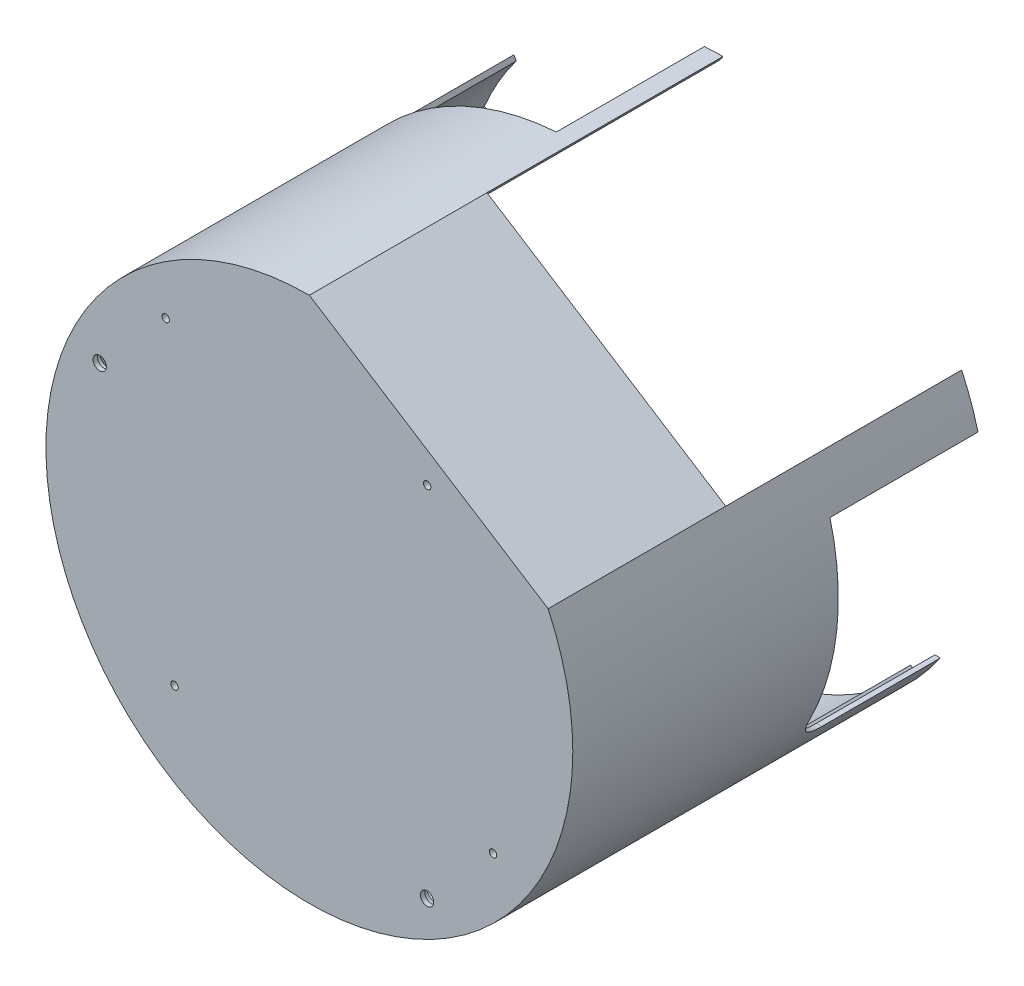
from build123d import *
from OCP.BRepFilletAPI import BRepFilletAPI_MakeChamfer

# Parameters (mm, degrees)
EXTRUDE_1_DEPTH      = 136
CUT_EXTRUDE_2_REACH  = 243.702
SKETCH_2_W           = 95.639330286
SKETCH_2_H           = 76
EXTRUDE_START        = -3
EXTRUDE_11_DEPTH     = 3
EXTRUDE5_REACH       = 255.243
EXTRUDE5_END_RADIUS  = 87.5
SKETCH_16_R          = 2.25
CUT_EXTRUDE_12_DEPTH = 1.5
SKETCH_17_R          = 3
CUT_EXTRUDE_13_DEPTH = 2
CUT_EXTRUDE_START    = -10
CUT_EXTRUDE_22_DEPTH = 62
EXTRUDE_25_DEPTH     = 57
EXTRUDE_26_DEPTH     = 133
EXTRUDE_START_2      = 133
EXTRUDE_27_DEPTH     = 133
EXTRUDE3_DEPTH       = 20
SKETCH_37_R          = 3
EXTRUDE_28_DEPTH     = 6
CHAMFER_1_SIZE       = 3
CHAMFER_1_SIZE2      = 0.528980942
CUT_EXTRUDE_1_DEPTH  = 100
HOLE_WIZARD_M3_1_D   = 2.5
SKETCH5_W            = 209.532613274
SKETCH5_H            = 81.520678674
CUT_EXTRUDE1_DEPTH   = 342
BOSS_EXTRUDE1_START  = 60
BOSS_EXTRUDE1_DEPTH  = 60
CUT_EXTRUDE2_DEPTH   = 50
FILLET1_R            = 10


with BuildPart() as part:
    # 草图1 → 拉伸1 (new body)
    with BuildSketch(Plane.XY):
        with BuildLine():
            Line((80.661393046, 37.613025295), (0, 89))
            ThreePointArc((0, 89), (-47.819665143, -75.061838677), (80.661393046, 37.613025295))
        make_face()
        with BuildLine():
            Line((-0.435508867, 87.498916176), (79.485003088, 36.583934781))
            ThreePointArc((79.485003088, 36.583934781), (-47.01371573, -73.796751509), (-0.435508867, 87.498916176))
        make_face(mode=Mode.SUBTRACT)
    extrude(amount=EXTRUDE_1_DEPTH)

    # 草图2 → 拉伸2 (cut, up to next)
    with BuildSketch(Plane(origin=(40.330696523, 63.306512647, 0), x_dir=(0.8433914458128872, -0.5372996083468217, 0), z_dir=(0.5372996083468217, 0.8433914458128872, 0)), mode=Mode.PRIVATE) as cut_extrude_2_sk1:
        with Locations((0, -38)):
            Rectangle(SKETCH_2_W, SKETCH_2_H)
    cut_extrude_2_tool1 = extrude(cut_extrude_2_sk1.sketch, amount=-CUT_EXTRUDE_2_REACH, mode=Mode.PRIVATE) & part.part
    add(cut_extrude_2_tool1.solids().sort_by_distance((40.330697, 63.306513, 38))[0], mode=Mode.SUBTRACT)

    # 草图15 → 拉伸11 (add)
    with BuildSketch(Plane.XY.offset(136).offset(EXTRUDE_START)):
        with BuildLine():
            Line((80.661393046, 37.613025295), (0, 89))
            ThreePointArc((0, 89), (-47.819665143, -75.061838677), (80.661393046, 37.613025295))
        make_face()
    extrude(amount=EXTRUDE_11_DEPTH)

    # Extrude5: up to this cylinder (the profile starts outside it)
    extrude5_end = Plane(origin=(0, 0, 93.5), z_dir=(0, 0, -1)) * Cylinder(EXTRUDE5_END_RADIUS, 686.486, mode=Mode.PRIVATE)
    # Sketch3 → Extrude5 (cut, up to the surface)
    with BuildSketch(Plane(origin=(-47.819665143, -75.061838677, 136), x_dir=(0.8433914458128872, -0.5372996083468216, 0), z_dir=(-0.5372996083468216, -0.8433914458128872, 0)), mode=Mode.PRIVATE) as extrude5_sk1:
        with BuildLine():
            Line((55, -30), (55, -55))
            ThreePointArc((55, -55), (45, -65), (35, -55))
            Line((35, -55), (35, -30))
            ThreePointArc((35, -30), (45, -20), (55, -30))
        make_face()
    extrude5_tool1 = extrude(extrude5_sk1.sketch, amount=-EXTRUDE5_REACH, mode=Mode.PRIVATE) - extrude5_end
    extrude5 = extrude5_tool1.solids().sort_by_distance((-9.86705, -99.240321, 93.5))[0]
    add(extrude5, mode=Mode.SUBTRACT)

    # Mirror2: Extrude5 across plane
    add(extrude5.mirror(Plane(origin=(0, 0, 0), x_dir=(0, 0, 1), z_dir=(-0.8433914458128872, 0.5372996083468218, 0))), mode=Mode.SUBTRACT)

    # 草图16 → 拉伸12 (cut)
    with BuildSketch(Plane.XY.offset(136)):
        with Locations((39.757225486, -67.626644318)):
            Circle(SKETCH_16_R)
        with Locations((-70.834375036, 33.711886825)):
            Circle(SKETCH_16_R)
    extrude(amount=-CUT_EXTRUDE_12_DEPTH, mode=Mode.SUBTRACT)

    # 草图17 → 拉伸13 (cut)
    with BuildSketch(Plane.XY.offset(134.5)):
        with Locations((-70.834375036, 33.711886825)):
            Circle(SKETCH_17_R)
        with Locations((39.757225486, -67.626644318)):
            Circle(SKETCH_17_R)
    extrude(amount=-CUT_EXTRUDE_13_DEPTH, mode=Mode.SUBTRACT)

    # 草图22 → 拉伸22 (cut)
    with BuildSketch(Plane(origin=(40.330696523, -25.693487353, 0), x_dir=(0, 0, -1), z_dir=(0.8433914458128853, -0.5372996083468244, 0)).offset(CUT_EXTRUDE_START)):
        with BuildLine():
            Line((-23, 17.061838677), (5, 17.061838677))
            Line((5, 17.061838677), (5, 75.061838677))
            Line((5, 75.061838677), (-55, 75.061838677))
            Line((-55, 75.061838677), (-55, 49.061838677))
            ThreePointArc((-55, 49.061838677), (-45.627416998, 26.434421679), (-23, 17.061838677))
        make_face()
    cut_extrude_22 = extrude(amount=CUT_EXTRUDE_22_DEPTH, mode=Mode.SUBTRACT)

    # 镜向6: 拉伸22 across plane
    add(cut_extrude_22.mirror(Plane(origin=(0, 0, 0), x_dir=(0, 0, 1), z_dir=(-0.8433914458128872, 0.5372996083468218, 0))), mode=Mode.SUBTRACT)

    # 草图28 → 拉伸25 (add)
    with BuildSketch(Plane(origin=(0, 0, 133), x_dir=(-1, 0, 0), z_dir=(0, 0, -1))):
        Polygon((-37.837964219, 63.116024695), (-41.211530002, 60.966826262), (-40.136930786, 59.28004337), (-36.763365002, 61.429241804), align=None)
    extrude(amount=EXTRUDE_25_DEPTH)

    # 草图29 → 拉伸26 (add)
    with BuildSketch(Plane(origin=(0, 0, 133), x_dir=(-1, 0, 0), z_dir=(0, 0, -1))):
        with BuildLine():
            Line((75.338803478, -41.473662612), (77.185797931, -37.92561928))
            Line((77.185797931, -37.92561928), (78.980816488, -38.807610426))
            ThreePointArc((78.980816488, -38.807610426), (78.05695332, -40.633877965), (77.090868675, -42.438166394))
            Line((77.090868675, -42.438166394), (75.338803478, -41.473662612))
        make_face()
    extrude_26 = extrude(amount=EXTRUDE_26_DEPTH)

    # 草图34 → 拉伸27 (add)
    with BuildSketch(Plane(origin=(0, 0, 133), x_dir=(-1, 0, 0), z_dir=(0, 0, -1)).offset(EXTRUDE_START_2)):
        with BuildLine():
            Line((-62.156877276, -61.585490233), (-60.704344554, -60.210663448))
            Line((-60.704344554, -60.210663448), (-63.453998125, -57.305598003))
            Line((-63.453998125, -57.305598003), (-64.906530847, -58.680424788))
            ThreePointArc((-64.906530847, -58.680424788), (-63.548306605, -60.14867187), (-62.156877276, -61.585490233))
        make_face()
    extrude_27 = extrude(amount=-EXTRUDE_27_DEPTH)

    # 镜向9: 拉伸26 across plane
    add(extrude_26.mirror(Plane(origin=(0, 0, 0), x_dir=(0, 0, 1), z_dir=(0.843391445812887, -0.5372996083468216, 0))))

    # 镜向8: 拉伸27 across plane
    add(extrude_27.mirror(Plane(origin=(0, 0, 0), x_dir=(0, 0, 1), z_dir=(-0.8433914458128872, 0.5372996083468218, 0))))

    # Sketch1 → Extrude3 (cut)
    with BuildSketch(Plane(origin=(0, 0, 0), x_dir=(-1, 0, 0), z_dir=(0, 0, -1))):
        with BuildLine():
            Line((89.490548743, 1.300648151), (-9.095314037, -89.036651232))
            ThreePointArc((-9.095314037, -89.036651232), (60.465323582, -65.986321645), (89.490548743, 1.300648151))
        make_face()
    extrude(amount=-EXTRUDE3_DEPTH, mode=Mode.SUBTRACT)

    # 草图37 → 拉伸28 (add)
    with BuildSketch(Plane.XY.offset(136)):
        with Locations((62.051702337, -43.296492203)):
            Circle(SKETCH_37_R)
        with Locations((-48.539898185, 58.042038939)):
            Circle(SKETCH_37_R)
        with Locations((-45.540130984, -47.984203518)):
            Circle(SKETCH_37_R)
        with Locations((39.788138776, 53.32124194)):
            Circle(SKETCH_37_R)
    extrude(amount=-EXTRUDE_28_DEPTH)

    # 倒角1: one chamfer whose edges measure the first distance from different faces: ONE call of the kernel's chamfer builder (chamfer() names one face for all edges)
    chamfer_1_edges_1 = [part.edges().sort_by_distance(p)[0] for p in [
        (59.051702337, -43.296492203, 130),
    ]]
    chamfer_1_side_1 = [part.faces().sort_by_distance(p)[0] for p in [
        (62.051702337, -43.296492203, 130),
    ]]
    chamfer_1_edges_2 = [part.edges().sort_by_distance(p)[0] for p in [
        (-51.539898185, 58.042038939, 130),
    ]]
    chamfer_1_side_2 = [part.faces().sort_by_distance(p)[0] for p in [
        (-48.539898185, 58.042038939, 130),
    ]]
    chamfer_1_edges_3 = [part.edges().sort_by_distance(p)[0] for p in [
        (-48.540130984, -47.984203518, 130),
    ]]
    chamfer_1_side_3 = [part.faces().sort_by_distance(p)[0] for p in [
        (-45.540130984, -47.984203518, 130),
    ]]
    chamfer_1_edges_4 = [part.edges().sort_by_distance(p)[0] for p in [
        (36.788138776, 53.32124194, 130),
    ]]
    chamfer_1_side_4 = [part.faces().sort_by_distance(p)[0] for p in [
        (39.788138776, 53.32124194, 130),
    ]]
    chamfer_1 = BRepFilletAPI_MakeChamfer(part.part.solid().wrapped)
    for e in chamfer_1_edges_1:
        chamfer_1.Add(CHAMFER_1_SIZE, CHAMFER_1_SIZE2, e.wrapped, chamfer_1_side_1[0].wrapped)  # the first distance lies on this face
    for e in chamfer_1_edges_2:
        chamfer_1.Add(CHAMFER_1_SIZE, CHAMFER_1_SIZE2, e.wrapped, chamfer_1_side_2[0].wrapped)  # the first distance lies on this face
    for e in chamfer_1_edges_3:
        chamfer_1.Add(CHAMFER_1_SIZE, CHAMFER_1_SIZE2, e.wrapped, chamfer_1_side_3[0].wrapped)  # the first distance lies on this face
    for e in chamfer_1_edges_4:
        chamfer_1.Add(CHAMFER_1_SIZE, CHAMFER_1_SIZE2, e.wrapped, chamfer_1_side_4[0].wrapped)  # the first distance lies on this face
    add(Compound.cast(chamfer_1.Shape()), mode=Mode.REPLACE)

    # 草图42 → 切除-拉伸1 (cut)
    with BuildSketch(Plane(origin=(0, 0, 0), x_dir=(0, 0, -1), z_dir=(0.9762960071199331, 0.2164396139381039, 0))):
        with BuildLine():
            Line((-23, -34.5), (10, -34.5))
            Line((10, -34.5), (10, -1.5))
            Line((10, -1.5), (10, 31.5))
            Line((10, 31.5), (-23, 31.5))
            ThreePointArc((-23, 31.5), (-56, -1.5), (-23, -34.5))
        make_face()
    cut_extrude_1 = extrude(amount=-CUT_EXTRUDE_1_DEPTH, mode=Mode.SUBTRACT)

    # 镜向10: 切除-拉伸1 across plane
    add(cut_extrude_1.mirror(Plane(origin=(0, 0, 0), x_dir=(0, 0, 1), z_dir=(0.843391445812887, -0.5372996083468216, 0))), mode=Mode.SUBTRACT)

    # M3 螺纹孔1 (through all)
    with Locations(Plane(origin=(-48.539898185, 58.042038939, 136), x_dir=(1, 0, 0), z_dir=(0, 0, 1))):
        with Locations((0, 0), (110.591600522, -101.338531142), (2.999767201, -106.026242457), (88.328036961, -4.720796999)):
            Hole(HOLE_WIZARD_M3_1_D / 2)

    # Sketch5 → Cut-Extrude1 (cut)
    with BuildSketch(Plane(origin=(40.330696523, 63.306512647, 0), x_dir=(0.8433914458128873, -0.5372996083468216, 0), z_dir=(0.5372996083468216, 0.8433914458128873, 0))):
        with Locations((3.023899986, -15.539277467)):
            Rectangle(SKETCH5_W, SKETCH5_H)
    extrude(amount=-CUT_EXTRUDE1_DEPTH, mode=Mode.SUBTRACT)

    # Sketch7 → Boss-Extrude1 (add)
    with BuildSketch(Plane(origin=(0, 0, 56.299616804), x_dir=(-1, 0, 0), z_dir=(0, 0, -1)).offset(BOSS_EXTRUDE1_START)):
        with BuildLine():
            Line((-63.453998125, -57.305598003), (-64.906530847, -58.680424788))
            ThreePointArc((-64.906530847, -58.680424788), (-86.453103395, -13.494847657), (-79.702439873, 36.10777033))
            Line((-79.702439873, 36.10777033), (-80.661393046, 37.613025295))
            ThreePointArc((-80.661393046, 37.613025295), (47.819665143, -75.061838677), (0, 89))
            Line((0, 89), (0.958953173, 87.494745035))
            ThreePointArc((0.958953173, 87.494745035), (48.767145796, 72.649951761), (80.613211175, 34.025875214))
            Line((80.613211175, 34.025875214), (78.753328099, 33.290460403))
            Line((78.753328099, 33.290460403), (80.224157721, 29.570694252))
            Line((80.224157721, 29.570694252), (82.084040797, 30.306109063))
            ThreePointArc((82.084040797, 30.306109063), (87.383935059, -4.505318376), (78.532061848, -38.587112639))
            Line((78.532061848, -38.587112639), (77.185797931, -37.92561928))
            Line((77.185797931, -37.92561928), (75.338803478, -41.473662612))
            Line((75.338803478, -41.473662612), (76.652852376, -42.197040449))
            ThreePointArc((76.652852376, -42.197040449), (47.01371573, -73.796751509), (5.84861112, -87.304316892))
            Line((5.84861112, -87.304316892), (5.748349215, -85.80767146))
            Line((5.748349215, -85.80767146), (1.752156329, -85.982149009))
            Line((1.752156329, -85.982149009), (1.782717195, -87.481837654))
            ThreePointArc((1.782717195, -87.481837654), (-32.846841611, -81.100770626), (-62.156877276, -61.585490233))
            Line((-62.156877276, -61.585490233), (-60.704344554, -60.210663448))
            Line((-60.704344554, -60.210663448), (-63.453998125, -57.305598003))
        make_face()
    extrude(amount=-BOSS_EXTRUDE1_DEPTH)

    # Sketch9 → Cut-Extrude2 (cut)
    with BuildSketch(Plane(origin=(0, 0, -3.700383196), x_dir=(-1, 0, 0), z_dir=(0, 0, -1))):
        Polygon((65.170962706, -34.365616827), (86.047991604, -67.135987981), (24.48041606, -106.358859391), (3.603387162, -73.588488237), align=None)
        Polygon((-57.767113825, 23.443580624), (-96.585602184, 21.748728819), (-93.401386907, -51.181791356), (-54.582898547, -49.486939552), align=None)
        Polygon((56.950373283, 28.075959091), (74.891832745, 62.541182049), (10.140041923, 96.248830815), (-7.801417539, 61.783607857), align=None)
    extrude(amount=-CUT_EXTRUDE2_DEPTH, mode=Mode.SUBTRACT)

    # Fillet1
    # the kernel refuses this fillet: 10 mm, written as the material it adds along each edge
    with BuildSketch(Plane(origin=(-58.258057696, 30.587997476, 46.299616804), x_dir=(0.8870108331782199, 0.4617486132350373, 0), z_dir=(-0.46174861323503724, 0.88701083317822, 0))) as fillet1_piece_1_section:
        with BuildLine():
            CenterArc((FILLET1_R, FILLET1_R), FILLET1_R, 180, 90)
            Line((0, FILLET1_R), (0, 0))
            Line((0, 0), (FILLET1_R, 0))
        make_face()
    fillet1_piece_1 = extrude(amount=51.657562465, mode=Mode.PRIVATE)
    fillet1_piece_1 = fillet1_piece_1 - Plane(origin=(0, 0, 44.055029957), x_dir=(-0.010959464832800272, 0.9999399432618835, 0), z_dir=(0, 0, -1)) * Cylinder(87.5, 144, mode=Mode.PRIVATE)
    fillet1_piece_1 = fillet1_piece_1 & Plane(origin=(0, 0, 44.055029957), x_dir=(0.9063077870366477, 0.4226182617407044, 0), z_dir=(0, 0, -1)) * Cylinder(89, 144, mode=Mode.PRIVATE)
    add(fillet1_piece_1)
    with BuildSketch(Plane(origin=(98.392696732, -51.399716649, 46.299616804), x_dir=(0.04361938736533167, 0.9990482215818579, 0), z_dir=(-0.9990482215818579, 0.04361938736533167, 0))) as fillet1_piece_2_section:
        with BuildLine():
            CenterArc((FILLET1_R, FILLET1_R), FILLET1_R, 180, 90)
            Line((0, FILLET1_R), (0, 0))
            Line((0, 0), (FILLET1_R, 0))
        make_face()
    fillet1_piece_2 = extrude(amount=51.773168669, mode=Mode.PRIVATE)
    fillet1_piece_2 = fillet1_piece_2 - Plane(origin=(0, 0, 44.050269431), x_dir=(0.9084000352933371, 0.41810211178498474, 0), z_dir=(0, 0, -1)) * Cylinder(87.5, 144, mode=Mode.PRIVATE)
    fillet1_piece_2 = fillet1_piece_2 & Plane(origin=(0, 0, 44.050269431), x_dir=(0.9063077870366477, 0.4226182617407044, 0), z_dir=(0, 0, -1)) * Cylinder(89, 144, mode=Mode.PRIVATE)
    add(fillet1_piece_2)
    with BuildSketch(Plane(origin=(-60.079286709, -26.37328645, 46.299616804), x_dir=(0, 0, -1), z_dir=(-0.5372996083468203, -0.843391445812888, 0))) as fillet1_piece_3_section:
        with BuildLine():
            CenterArc((FILLET1_R, FILLET1_R), FILLET1_R, 180, 90)
            Line((0, FILLET1_R), (0, 0))
            Line((0, 0), (FILLET1_R, 0))
        make_face()
    fillet1_piece_3 = extrude(amount=51.647534144, mode=Mode.PRIVATE)
    fillet1_piece_3 = fillet1_piece_3 - Plane(origin=(0, 0, 44.055481192), x_dir=(-0.8760325985824965, -0.48225189084211867, 0), z_dir=(0, 0, -1)) * Cylinder(87.5, 144, mode=Mode.PRIVATE)
    fillet1_piece_3 = fillet1_piece_3 & Plane(origin=(0, 0, 44.055481192), x_dir=(0.9063077870366477, 0.4226182617407044, 0), z_dir=(0, 0, -1)) * Cylinder(89, 144, mode=Mode.PRIVATE)
    add(fillet1_piece_3)
    with BuildSketch(Plane(origin=(-26.261911032, -109.155246354, 46.299616804), x_dir=(0, 0, -1), z_dir=(0.53729960834682, 0.8433914458128882, 0))) as fillet1_piece_4_section:
        with BuildLine():
            CenterArc((FILLET1_R, FILLET1_R), FILLET1_R, 180, 90)
            Line((0, FILLET1_R), (0, 0))
            Line((0, 0), (FILLET1_R, 0))
        make_face()
    fillet1_piece_4 = extrude(amount=51.647534144, mode=Mode.PRIVATE)
    fillet1_piece_4 = fillet1_piece_4 - Plane(origin=(0, 0, 44.055467586), x_dir=(-0.8760325985824965, -0.48225189084211867, 0), z_dir=(0, 0, -1)) * Cylinder(87.5, 144, mode=Mode.PRIVATE)
    fillet1_piece_4 = fillet1_piece_4 & Plane(origin=(0, 0, 44.055467586), x_dir=(0.9063077870366477, 0.4226182617407044, 0), z_dir=(0, 0, -1)) * Cylinder(89, 144, mode=Mode.PRIVATE)
    add(fillet1_piece_4)


solid = part.part
